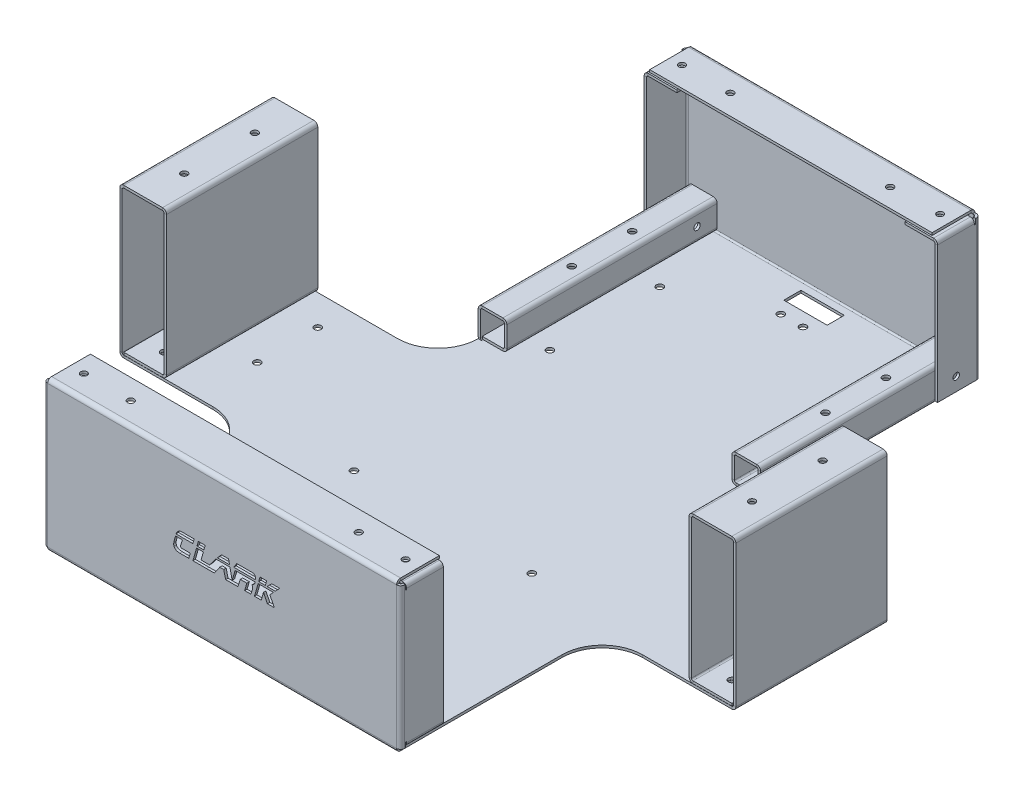
from build123d import *

# Parameters (mm, degrees)
BASE_FLANGE1_DEPTH                       = 1.21
M3_CLEARANCE_HOLE2_AT_2_COUNT            = 2
M3_CLEARANCE_HOLE2_AT_2_PITCH            = 66
M3_CLEARANCE_HOLE2_AT_3_COUNT            = 2
M3_CLEARANCE_HOLE2_AT_3_PITCH            = 86.678897774
FILLET1_R                                = 20
SIDE_WALL_FLANGE1_STRIP_W                = 6.364
SIDE_WALL_FLANGE1_STRIP_H                = 1.21
SIDE_WALL_FLANGE1_STRIP_CUT_DEPTH        = 75
SIDE_WALL_FLANGE1_DEPTH                  = 75
SIDE_WALL_FLANGE2_STRIP_W                = 6.364
SIDE_WALL_FLANGE2_STRIP_H                = 1.21
SIDE_WALL_FLANGE2_STRIP_CUT_DEPTH        = 140
SIDE_WALL_FLANGE2_DEPTH                  = 140
EDGE_FLANGE3_DEPTH                       = 173
SKETCH62_W                               = 21.5
SKETCH62_H                               = 8.5
QRD_CLEARANCE_DEPTH                      = 10
QRD_HOLES_D                              = 3.4
QRD_HOLES_DEPTH                          = 1.27
QRD_HOLES_TIP                            = 1.021463052
SIDE_WALL_FLANGE3_DEPTH                  = 75
TAP_START                                = 71.762
TAP_DRILL_FOR_M4X0_7_TAP3_OUTLINE_R      = 1.65
TAP_DRILL_FOR_M4X0_7_TAP3_DEPTH          = 1.21
EDGE_FLANGE6_DEPTH                       = 140
SIDE_WALL_FLANGE4_DEPTH                  = 75
SIDE_START                               = -175
SIDE_WALL_FLANGE5_DEPTH                  = 75
EDGE_FLANGE10_DEPTH                      = 173
TAP_DRILL_FOR_M4X0_7_TAP1_REACH          = 393.729
TAP_DRILL_FOR_M4X0_7_TAP1_BORE_R         = 1.65
TAP_DRILL_FOR_M4X0_7_TAP2_REACH          = 393.729
TAP_DRILL_FOR_M4X0_7_TAP2_BORE_R         = 1.65
M3_CLEARANCE_HOLE9_D                     = 3.4
M3_CLEARANCE_HOLE9_DEPTH                 = 2.51
FRONT_WHEEL_SUPPORT1_STRIP_W             = 6.364
FRONT_WHEEL_SUPPORT1_STRIP_H             = 1.21
FRONT_WHEEL_SUPPORT1_STRIP_CUT_DEPTH     = 104.238
FRONT_WHEEL_SUPPORT1_DEPTH               = 104.238
FRONT_WHEEL_SUPPORT2_STRIP_W             = 6.364
FRONT_WHEEL_SUPPORT2_STRIP_H             = 1.21
FRONT_WHEEL_SUPPORT2_STRIP_CUT_DEPTH     = 104.238
FRONT_WHEEL_SUPPORT2_DEPTH               = 104.238
FRONT_WHEEL_SUPPORT3_STRIP_W             = 6.364
FRONT_WHEEL_SUPPORT3_STRIP_H             = 1.21
FRONT_WHEEL_SUPPORT3_STRIP_CUT_DEPTH     = 104.238
FRONT_WHEEL_SUPPORT3_DEPTH               = 104.238
FRONT_START                              = -299.238
FRONT_WHEEL_SUPPORT4_DEPTH               = 104.238
FRONT_WHEEL_SUPPORT4_2_DEPTH             = 104.238
M3_STEERING_BOX_D                        = 3.4
M3_STEERING_BOX_DEPTH                    = 3
M3_STEERING_BOX_TIP                      = 1.021463052
M3_CLEARANCE_HOLE10_D                    = 3.4
M3_CLEARANCE_HOLE11_D                    = 3.4
REAR_WALL_SIDE_FLANGE1_DEPTH             = 70.238
REAR_WALL_SIDE_FLANGE2_STRIP_W           = 6.364
REAR_WALL_SIDE_FLANGE2_STRIP_H           = 1.21
REAR_WALL_SIDE_FLANGE2_STRIP_CUT_DEPTH   = 18.238
REAR_WALL_SIDE_FLANGE2_RELIEF_W          = 6.969
REAR_WALL_SIDE_FLANGE2_RELIEF_H          = 0.605
REAR_WALL_SIDE_FLANGE2_RELIEF_CUT_DEPTH  = 1.21
REAR_WALL_SIDE_FLANGE2_DEPTH             = 18.238
REAR_WALL_SIDE_FLANGE3_STRIP_W           = 6.364
REAR_WALL_SIDE_FLANGE3_STRIP_H           = 1.21
REAR_WALL_SIDE_FLANGE3_STRIP_CUT_DEPTH   = 18.238
REAR_WALL_SIDE_FLANGE3_RELIEF_W          = 6.969
REAR_WALL_SIDE_FLANGE3_RELIEF_H          = 0.605
REAR_WALL_SIDE_FLANGE3_RELIEF_CUT_DEPTH  = 1.21
REAR_WALL_SIDE_FLANGE3_DEPTH             = 18.238
SKETCH157_R                              = 1.6
CUT_EXTRUDE12_DEPTH                      = 10
CUT_EXTRUDE13_START                      = -10
SKETCH158_R                              = 1.6
CUT_EXTRUDE13_DEPTH                      = 10
FRONT_WALL_SIDE_FLANGE1_DEPTH            = 69.601632971
FRONT_WALL_SIDE_FLANGE2_STRIP_W          = 6.364
FRONT_WALL_SIDE_FLANGE2_STRIP_H          = 1.21
FRONT_WALL_SIDE_FLANGE2_STRIP_CUT_DEPTH  = 18.238
FRONT_WALL_SIDE_FLANGE2_RELIEF_W         = 6.969
FRONT_WALL_SIDE_FLANGE2_RELIEF_H         = 0.605
FRONT_WALL_SIDE_FLANGE2_RELIEF_CUT_DEPTH = 1.21
FRONT_WALL_SIDE_FLANGE2_DEPTH            = 18.238
SKETCH172_R                              = 1.6
CUT_EXTRUDE15_DEPTH                      = 10
SKETCH179_R                              = 1.6
FRONT_WALL_RIVET_HOLE_DEPTH              = 374.529954467
H_BRIDGE_M3_CLEARANCE_AT_2_COUNT         = 2
H_BRIDGE_M3_CLEARANCE_AT_2_PITCH         = 30
CUT_EXTRUDE16_DEPTH                      = 1.21


# Read off the part's stored shape, not the designer's step: Tap Drill for M4x0.7 Tap3, Side Wall Flange5, Front Wheel Support4
# Sheet-metal steps are written as plain solids
with BuildPart() as part:
    # Sketch1 → Base-Flange1 (new body)
    with BuildSketch(Plane(origin=(0, 0, 0), x_dir=(1, 0, 0), z_dir=(0, 1, 0))):
        Polygon((0, 0), (173, 0), (173, 100), (238, 100), (238, 175), (156.5, 175), (156.5, 300), (16.5, 300), (16.5, 175), (-65, 175), (-65, 100), (0, 100), align=None)
    extrude(amount=-BASE_FLANGE1_DEPTH)

    # Sketch28 → M3 Clearance Hole2 (revolve, cut)
    with BuildSketch(Plane(origin=(9.052, -1.21, -27.479586063), x_dir=(0, 0, -1), z_dir=(1, 0, 0))):
        Polygon((0, 0), (0, 2.291463052), (1.7, 1.27), (1.7, 0), align=None)
    m3_clearance_hole2 = revolve(axis=Axis((9.052, -7.56, -27.479586063), (0, 1, 0)), mode=Mode.SUBTRACT)

    # M3 Clearance Hole2 at 2: M3 Clearance Hole2 ×2
    with Locations(*[(i * M3_CLEARANCE_HOLE2_AT_2_PITCH, 0, 0) for i in range(1, M3_CLEARANCE_HOLE2_AT_2_COUNT)]):
        add(m3_clearance_hole2, mode=Mode.SUBTRACT)

    # M3 Clearance Hole2 at 3: M3 Clearance Hole2 ×2
    with Locations(*[Vector(0.38492784467456836, 0, -0.9229466693120418) * (i * M3_CLEARANCE_HOLE2_AT_3_PITCH) for i in range(1, M3_CLEARANCE_HOLE2_AT_3_COUNT)]):
        add(m3_clearance_hole2, mode=Mode.SUBTRACT)

    # Mirror3: M3 Clearance Hole2 across plane
    add(m3_clearance_hole2.mirror(Plane(origin=(86.5, 0, 0), x_dir=(0, 0, 1), z_dir=(1, 0, 0))), mode=Mode.SUBTRACT)

    # Mirror3 copy 1 sketch → Mirror3 copy 1 (revolve, cut)
    with BuildSketch(Plane(origin=(97.948, -1.21, -27.479586063), x_dir=(0, 0, -1), z_dir=(-1, 0, 0))):
        Polygon((0, 0), (0, -2.291463052), (1.7, -1.27), (1.7, 0), align=None)
    revolve(axis=Axis((97.948, -7.56, -27.479586063), (0, -1, 0)), mode=Mode.SUBTRACT)

    # Mirror3 copy 2 sketch → Mirror3 copy 2 (revolve, cut)
    with BuildSketch(Plane(origin=(130.582878701, -1.21, -107.479586063), x_dir=(0, 0, -1), z_dir=(-1, 0, 0))):
        Polygon((0, 0), (0, -2.291463052), (1.7, -1.27), (1.7, 0), align=None)
    revolve(axis=Axis((130.582878701, -7.56, -107.479586063), (0, -1, 0)), mode=Mode.SUBTRACT)

    # Fillet1
    fillet1_edges = [part.edges().sort_by_distance(p)[0] for p in [
        (0, -0.605, -100),
        (16.5, -0.605, -175),
        (156.5, -0.605, -175),
        (173, -0.605, -100),
    ]]
    fillet(fillet1_edges, radius=FILLET1_R)

    # Side Wall Flange1 strip (across the edge) → Side Wall Flange1 strip cut (cut)
    with BuildSketch(Plane(origin=(238, 0, -100), x_dir=(-1, 0, 0), z_dir=(0, 0, -1))):
        with Locations((-2.42, -0.605)):
            Rectangle(SIDE_WALL_FLANGE1_STRIP_W, SIDE_WALL_FLANGE1_STRIP_H)
    side_wall_flange1_strip_cut = extrude(amount=SIDE_WALL_FLANGE1_STRIP_CUT_DEPTH, mode=Mode.SUBTRACT)

    # Side Wall Flange1 section (across the edge) → Side Wall Flange1 (add)
    with BuildSketch(Plane(origin=(238, 0, -100), x_dir=(-1, 0, 0), z_dir=(0, 0, -1))):
        with BuildLine():
            Line((-1.21, 0.762), (-1.21, 71))
            Line((-1.21, 71), (0, 71))
            Line((0, 71), (0, 0.762))
            ThreePointArc((0, 0.762), (0.223184633, 0.223184633), (0.762, 0))
            Line((0.762, 0), (0.762, -1.21))
            ThreePointArc((0.762, -1.21), (-0.632414572, -0.632414572), (-1.21, 0.762))
        make_face()
    side_wall_flange1 = extrude(amount=SIDE_WALL_FLANGE1_DEPTH)

    # Side Wall Flange2 strip (across the edge) → Side Wall Flange2 strip cut (cut)
    with BuildSketch(Plane(origin=(156.5, 0, -300), x_dir=(0, 0, 1), z_dir=(-1, 0, 0))):
        with Locations((-2.42, -0.605)):
            Rectangle(SIDE_WALL_FLANGE2_STRIP_W, SIDE_WALL_FLANGE2_STRIP_H)
    extrude(amount=SIDE_WALL_FLANGE2_STRIP_CUT_DEPTH, mode=Mode.SUBTRACT)

    # Side Wall Flange2 section (across the edge) → Side Wall Flange2 (add)
    with BuildSketch(Plane(origin=(156.5, 0, -300), x_dir=(0, 0, 1), z_dir=(-1, 0, 0))):
        with BuildLine():
            Line((-1.21, 0.762), (-1.21, 71))
            Line((-1.21, 71), (0, 71))
            Line((0, 71), (0, 0.762))
            ThreePointArc((0, 0.762), (0.223184633, 0.223184633), (0.762, 0))
            Line((0.762, 0), (0.762, -1.21))
            ThreePointArc((0.762, -1.21), (-0.632414572, -0.632414572), (-1.21, 0.762))
        make_face()
    extrude(amount=SIDE_WALL_FLANGE2_DEPTH)

    # Side Wall Mirror: Side Wall Flange1 strip cut, Side Wall Flange1 across plane
    add(side_wall_flange1_strip_cut.mirror(Plane(origin=(86.5, 0, 0), x_dir=(0, 0, 1), z_dir=(1, 0, 0))), mode=Mode.SUBTRACT)
    add(side_wall_flange1.mirror(Plane(origin=(86.5, 0, 0), x_dir=(0, 0, 1), z_dir=(1, 0, 0))))

    # Edge-Flange3 section (across the edge) → Edge-Flange3 (add)
    with BuildSketch(Plane(origin=(0, 0, 0.762), x_dir=(0, 0, -1), z_dir=(1, 0, 0))):
        with BuildLine():
            Line((-1.21, 0.762), (-1.21, 71))
            Line((-1.21, 71), (0, 71))
            Line((0, 71), (0, 0.762))
            ThreePointArc((0, 0.762), (0.223184633, 0.223184633), (0.762, 0))
            Line((0.762, 0), (0.762, -1.21))
            ThreePointArc((0.762, -1.21), (-0.632414572, -0.632414572), (-1.21, 0.762))
        make_face()
    extrude(amount=EDGE_FLANGE3_DEPTH)

    # Sketch62 → QRD Clearance (cut)
    with BuildSketch(Plane(origin=(0, 0, 0), x_dir=(1, 0, 0), z_dir=(0, 1, 0))):
        with Locations((86.5, 291.488)):
            Rectangle(SKETCH62_W, SKETCH62_H)
    extrude(amount=-QRD_CLEARANCE_DEPTH, mode=Mode.SUBTRACT)

    # QRD Holes
    with Locations(Plane(origin=(0, 0, 0), x_dir=(1, 0, 0), z_dir=(0, 1, 0))):
        with Locations((92, 280.488), (81, 280.488)):
            Hole(QRD_HOLES_D / 2, depth=QRD_HOLES_DEPTH)
            with Locations((0, 0, -(QRD_HOLES_DEPTH + QRD_HOLES_TIP / 2))):  # 118° drill point
                Cone(0, QRD_HOLES_D / 2, QRD_HOLES_TIP, mode=Mode.SUBTRACT)

    # Side Wall Flange3 section (across the edge) → Side Wall Flange3 (add)
    with BuildSketch(Plane(origin=(-65, 71.762, -175), x_dir=(0, -1, 0), z_dir=(0, 0, 1))):
        with BuildLine():
            Line((-1.21, 0.762), (-1.21, 20))
            Line((-1.21, 20), (0, 20))
            Line((0, 20), (0, 0.762))
            ThreePointArc((0, 0.762), (0.223184633, 0.223184633), (0.762, 0))
            Line((0.762, 0), (0.762, -1.21))
            ThreePointArc((0.762, -1.21), (-0.632414572, -0.632414572), (-1.21, 0.762))
        make_face()
    side_wall_flange3 = extrude(amount=SIDE_WALL_FLANGE3_DEPTH)

    # Tap Drill for M4x0.7 Tap3 outline → Tap Drill for M4x0.7 Tap3 (cut)
    with BuildSketch(Plane(origin=(0, 0, 0), x_dir=(1, 0, 0), z_dir=(0, 1, 0)).offset(TAP_START)):
        with Locations((-54.238, 120)):
            Circle(TAP_DRILL_FOR_M4X0_7_TAP3_OUTLINE_R)
        with Locations((-54.238, 155)):
            Circle(TAP_DRILL_FOR_M4X0_7_TAP3_OUTLINE_R)
    tap_drill_for_m4x0_7_tap3 = extrude(amount=TAP_DRILL_FOR_M4X0_7_TAP3_DEPTH, mode=Mode.SUBTRACT)

    # Mirror6: Side Wall Flange3, Tap Drill for M4x0.7 Tap3 across plane
    add(side_wall_flange3.mirror(Plane(origin=(86.5, 0, 0), x_dir=(0, 0, 1), z_dir=(1, 0, 0))))
    add(tap_drill_for_m4x0_7_tap3.mirror(Plane(origin=(86.5, 0, 0), x_dir=(0, 0, 1), z_dir=(1, 0, 0))), mode=Mode.SUBTRACT)

    # Edge-Flange6 section (across the edge) → Edge-Flange6 (add)
    with BuildSketch(Plane(origin=(156.5, 71.762, -300), x_dir=(0, -1, 0), z_dir=(-1, 0, 0))):
        with BuildLine():
            Line((-1.21, 0.762), (-1.21, 20))
            Line((-1.21, 20), (0, 20))
            Line((0, 20), (0, 0.762))
            ThreePointArc((0, 0.762), (0.223184633, 0.223184633), (0.762, 0))
            Line((0.762, 0), (0.762, -1.21))
            ThreePointArc((0.762, -1.21), (-0.632414572, -0.632414572), (-1.21, 0.762))
        make_face()
    extrude(amount=EDGE_FLANGE6_DEPTH)

    # Side Wall Flange4 section (across the edge) → Side Wall Flange4 (add)
    with BuildSketch(Plane(origin=(-44.238, 71.762, -175), x_dir=(-1, 0, 0), z_dir=(0, 0, 1))):
        with BuildLine():
            Line((-1.21, 0.762), (-1.21, 69.7))
            Line((-1.21, 69.7), (0, 69.7))
            Line((0, 69.7), (0, 0.762))
            ThreePointArc((0, 0.762), (0.223184633, 0.223184633), (0.762, 0))
            Line((0.762, 0), (0.762, -1.21))
            ThreePointArc((0.762, -1.21), (-0.632414572, -0.632414572), (-1.21, 0.762))
        make_face()
    side_wall_flange4 = extrude(amount=SIDE_WALL_FLANGE4_DEPTH)

    # Side Wall Flange5 outline → Side Wall Flange5 (add)
    with BuildSketch(Plane.XY.offset(SIDE_START)):
        with BuildLine():
            Line((-64.238, 0.09), (-45, 0.09))
            ThreePointArc((-45, 0.09), (-43.605585427, 0.667585428), (-43.028, 2.062))
            Line((-43.028, 2.062), (-44.238, 2.062))
            ThreePointArc((-44.238, 2.062), (-44.461184633, 1.523184633), (-45, 1.3))
            Line((-45, 1.3), (-64.238, 1.3))
            Line((-64.238, 1.3), (-64.238, 0.09))
        make_face()
    side_wall_flange5 = extrude(amount=SIDE_WALL_FLANGE5_DEPTH)

    # Mirror7: Side Wall Flange4, Side Wall Flange5 across plane
    add(side_wall_flange4.mirror(Plane(origin=(86.5, 0, 0), x_dir=(0, 0, 1), z_dir=(1, 0, 0))))
    add(side_wall_flange5.mirror(Plane(origin=(86.5, 0, 0), x_dir=(0, 0, 1), z_dir=(1, 0, 0))))

    # Edge-Flange10 section (across the edge) → Edge-Flange10 (add)
    with BuildSketch(Plane(origin=(0, 71.762, 0.762), x_dir=(0, -1, 0), z_dir=(1, 0, 0))):
        with BuildLine():
            Line((-1.21, 0.762), (-1.21, 20))
            Line((-1.21, 20), (0, 20))
            Line((0, 20), (0, 0.762))
            ThreePointArc((0, 0.762), (0.223184633, 0.223184633), (0.762, 0))
            Line((0.762, 0), (0.762, -1.21))
            ThreePointArc((0.762, -1.21), (-0.632414572, -0.632414572), (-1.21, 0.762))
        make_face()
    extrude(amount=EDGE_FLANGE10_DEPTH)

    # Tap Drill for M4x0.7 Tap1 bore → Tap Drill for M4x0.7 Tap1 (cut, up to next)
    with BuildSketch(Plane(origin=(0, 72.972, 0), x_dir=(1, 0, 0), z_dir=(0, 1, 0)), mode=Mode.PRIVATE) as tap_drill_for_m4x0_7_tap1_sk1:
        with Locations((29.999061496, 9.238)):
            Circle(TAP_DRILL_FOR_M4X0_7_TAP1_BORE_R)
    tap_drill_for_m4x0_7_tap1_tool1 = extrude(tap_drill_for_m4x0_7_tap1_sk1.sketch, amount=-TAP_DRILL_FOR_M4X0_7_TAP1_REACH, mode=Mode.PRIVATE) & part.part
    # Tap Drill for M4x0.7 Tap1 bore → Tap Drill for M4x0.7 Tap1 (cut, up to next)
    with BuildSketch(Plane(origin=(0, 72.972, 0), x_dir=(1, 0, 0), z_dir=(0, 1, 0)), mode=Mode.PRIVATE) as tap_drill_for_m4x0_7_tap1_sk2:
        with Locations((143, 9.238)):
            Circle(TAP_DRILL_FOR_M4X0_7_TAP1_BORE_R)
    tap_drill_for_m4x0_7_tap1_tool2 = extrude(tap_drill_for_m4x0_7_tap1_sk2.sketch, amount=-TAP_DRILL_FOR_M4X0_7_TAP1_REACH, mode=Mode.PRIVATE) & part.part
    add(tap_drill_for_m4x0_7_tap1_tool1.solids().sort_by_distance((29.999061, 72.972, -9.238))[0], mode=Mode.SUBTRACT)
    add(tap_drill_for_m4x0_7_tap1_tool2.solids().sort_by_distance((143, 72.972, -9.238))[0], mode=Mode.SUBTRACT)

    # Tap Drill for M4x0.7 Tap2 bore → Tap Drill for M4x0.7 Tap2 (cut, up to next)
    with BuildSketch(Plane(origin=(0, 72.972, 0), x_dir=(1, 0, 0), z_dir=(0, 1, 0)), mode=Mode.PRIVATE) as tap_drill_for_m4x0_7_tap2_sk1:
        with Locations((46.5, 290)):
            Circle(TAP_DRILL_FOR_M4X0_7_TAP2_BORE_R)
    tap_drill_for_m4x0_7_tap2_tool1 = extrude(tap_drill_for_m4x0_7_tap2_sk1.sketch, amount=-TAP_DRILL_FOR_M4X0_7_TAP2_REACH, mode=Mode.PRIVATE) & part.part
    # Tap Drill for M4x0.7 Tap2 bore → Tap Drill for M4x0.7 Tap2 (cut, up to next)
    with BuildSketch(Plane(origin=(0, 72.972, 0), x_dir=(1, 0, 0), z_dir=(0, 1, 0)), mode=Mode.PRIVATE) as tap_drill_for_m4x0_7_tap2_sk2:
        with Locations((126.5, 289.238)):
            Circle(TAP_DRILL_FOR_M4X0_7_TAP2_BORE_R)
    tap_drill_for_m4x0_7_tap2_tool2 = extrude(tap_drill_for_m4x0_7_tap2_sk2.sketch, amount=-TAP_DRILL_FOR_M4X0_7_TAP2_REACH, mode=Mode.PRIVATE) & part.part
    add(tap_drill_for_m4x0_7_tap2_tool1.solids().sort_by_distance((46.5, 72.972, -290))[0], mode=Mode.SUBTRACT)
    add(tap_drill_for_m4x0_7_tap2_tool2.solids().sort_by_distance((126.5, 72.972, -289.238))[0], mode=Mode.SUBTRACT)

    # M3 Clearance Hole9
    with Locations(Plane(origin=(0, 1.3, 0), x_dir=(1, 0, 0), z_dir=(0, 1, 0))):
        with Locations((-54.238, 110), (-54.238, 165)):
            m3_clearance_hole9 = Hole(M3_CLEARANCE_HOLE9_D / 2, depth=M3_CLEARANCE_HOLE9_DEPTH)

    # Mirror10: M3 Clearance Hole9 across plane
    add(m3_clearance_hole9.mirror(Plane(origin=(86.5, 0, 0), x_dir=(0, 0, 1), z_dir=(1, 0, 0))), mode=Mode.SUBTRACT)

    # Front Wheel Support1 strip (across the edge) → Front Wheel Support1 strip cut (cut)
    with BuildSketch(Plane(origin=(156.5, 0, -195), x_dir=(-1, 0, 0), z_dir=(0, 0, -1))):
        with Locations((-1.21, -0.605)):
            Rectangle(FRONT_WHEEL_SUPPORT1_STRIP_W, FRONT_WHEEL_SUPPORT1_STRIP_H)
    front_wheel_support1_strip_cut = extrude(amount=FRONT_WHEEL_SUPPORT1_STRIP_CUT_DEPTH, mode=Mode.SUBTRACT)

    # Front Wheel Support1 section (across the edge) → Front Wheel Support1 (add)
    with BuildSketch(Plane(origin=(156.5, 0, -195), x_dir=(-1, 0, 0), z_dir=(0, 0, -1))):
        with BuildLine():
            Line((0, 0.762), (0, 15))
            Line((0, 15), (1.21, 15))
            Line((1.21, 15), (1.21, 0.762))
            ThreePointArc((1.21, 0.762), (1.433184633, 0.223184633), (1.972, 0))
            Line((1.972, 0), (1.972, -1.21))
            ThreePointArc((1.972, -1.21), (0.577585428, -0.632414572), (0, 0.762))
        make_face()
    front_wheel_support1 = extrude(amount=FRONT_WHEEL_SUPPORT1_DEPTH)

    # Front Wheel Support2 strip (across the edge) → Front Wheel Support2 strip cut (cut)
    with BuildSketch(Plane(origin=(155.29, 15, -195), x_dir=(0, -1, 0), z_dir=(0, 0, -1))):
        with Locations((-1.21, -0.605)):
            Rectangle(FRONT_WHEEL_SUPPORT2_STRIP_W, FRONT_WHEEL_SUPPORT2_STRIP_H)
    front_wheel_support2_strip_cut = extrude(amount=FRONT_WHEEL_SUPPORT2_STRIP_CUT_DEPTH, mode=Mode.SUBTRACT)

    # Front Wheel Support2 section (across the edge) → Front Wheel Support2 (add)
    with BuildSketch(Plane(origin=(155.29, 15, -195), x_dir=(0, -1, 0), z_dir=(0, 0, -1))):
        with BuildLine():
            Line((0, 0.762), (0, 13))
            Line((0, 13), (1.21, 13))
            Line((1.21, 13), (1.21, 0.762))
            ThreePointArc((1.21, 0.762), (1.433184633, 0.223184633), (1.972, 0))
            Line((1.972, 0), (1.972, -1.21))
            ThreePointArc((1.972, -1.21), (0.577585428, -0.632414572), (0, 0.762))
        make_face()
    front_wheel_support2 = extrude(amount=FRONT_WHEEL_SUPPORT2_DEPTH)

    # Front Wheel Support3 strip (across the edge) → Front Wheel Support3 strip cut (cut)
    with BuildSketch(Plane(origin=(142.29, 13.79, -195), x_dir=(1, 0, 0), z_dir=(0, 0, -1))):
        with Locations((-1.21, -0.605)):
            Rectangle(FRONT_WHEEL_SUPPORT3_STRIP_W, FRONT_WHEEL_SUPPORT3_STRIP_H)
    front_wheel_support3_strip_cut = extrude(amount=FRONT_WHEEL_SUPPORT3_STRIP_CUT_DEPTH, mode=Mode.SUBTRACT)

    # Front Wheel Support3 section (across the edge) → Front Wheel Support3 (add)
    with BuildSketch(Plane(origin=(142.29, 13.79, -195), x_dir=(1, 0, 0), z_dir=(0, 0, -1))):
        with BuildLine():
            Line((0, 0.762), (0, 13.028))
            Line((0, 13.028), (1.21, 13.028))
            Line((1.21, 13.028), (1.21, 0.762))
            ThreePointArc((1.21, 0.762), (1.433184633, 0.223184633), (1.972, 0))
            Line((1.972, 0), (1.972, -1.21))
            ThreePointArc((1.972, -1.21), (0.577585428, -0.632414572), (0, 0.762))
        make_face()
    front_wheel_support3 = extrude(amount=FRONT_WHEEL_SUPPORT3_DEPTH)

    # Front Wheel Support4 outline → Front Wheel Support4 (cut)
    with BuildSketch(Plane.XY.offset(FRONT_START)):
        with BuildLine():
            Line((143.5, 0.762), (143.5, 0.915170707))
            ThreePointArc((143.5, 0.915170707), (142.620133989, 1.641727141), (142.29, 2.734))
            Line((142.29, 2.734), (142.29, 0.762))
            Line((142.29, 0.762), (143.5, 0.762))
        make_face()
    front_wheel_support4 = extrude(amount=FRONT_WHEEL_SUPPORT4_DEPTH, mode=Mode.SUBTRACT)

    # Front Wheel Support4 2 outline → Front Wheel Support4 2 (add)
    with BuildSketch(Plane.XY.offset(FRONT_START)):
        with BuildLine():
            ThreePointArc((143.5, 0.915170707), (143.873378955, 0.800671864), (144.262, 0.762))
            Line((144.262, 0.762), (154.5, 0.762))
            Line((154.5, 0.762), (154.5, 1.972))
            Line((154.5, 1.972), (144.262, 1.972))
            ThreePointArc((144.262, 1.972), (143.723184633, 2.195184633), (143.5, 2.734))
            Line((143.5, 2.734), (143.5, 0.915170707))
        make_face()
    front_wheel_support4_2 = extrude(amount=FRONT_WHEEL_SUPPORT4_2_DEPTH)

    # Copy of Front Wheel Support: Front Wheel Support1 strip cut, Front Wheel Support1, Front Wheel Support2 strip cut, Front Wheel Support2, Front Wheel Support3 strip cut, Front Wheel Support3, Front Wheel Support4, Front Wheel Support4 2 across plane
    add(front_wheel_support1_strip_cut.mirror(Plane(origin=(86.5, 0, 0), x_dir=(0, 0, 1), z_dir=(1, 0, 0))), mode=Mode.SUBTRACT)
    add(front_wheel_support1.mirror(Plane(origin=(86.5, 0, 0), x_dir=(0, 0, 1), z_dir=(1, 0, 0))))
    add(front_wheel_support2_strip_cut.mirror(Plane(origin=(86.5, 0, 0), x_dir=(0, 0, 1), z_dir=(1, 0, 0))), mode=Mode.SUBTRACT)
    add(front_wheel_support2.mirror(Plane(origin=(86.5, 0, 0), x_dir=(0, 0, 1), z_dir=(1, 0, 0))))
    add(front_wheel_support3_strip_cut.mirror(Plane(origin=(86.5, 0, 0), x_dir=(0, 0, 1), z_dir=(1, 0, 0))), mode=Mode.SUBTRACT)
    add(front_wheel_support3.mirror(Plane(origin=(86.5, 0, 0), x_dir=(0, 0, 1), z_dir=(1, 0, 0))))
    add(front_wheel_support4.mirror(Plane(origin=(86.5, 0, 0), x_dir=(0, 0, 1), z_dir=(1, 0, 0))), mode=Mode.SUBTRACT)
    add(front_wheel_support4_2.mirror(Plane(origin=(86.5, 0, 0), x_dir=(0, 0, 1), z_dir=(1, 0, 0))))

    # M3 (Steering Box)
    with Locations(Plane(origin=(0, 0, 0), x_dir=(1, 0, 0), z_dir=(0, 1, 0))):
        with Locations((39.262, 262.238), (39.262, 207.762), (133.738, 207.762), (133.738, 262.238)):
            Hole(M3_STEERING_BOX_D / 2, depth=M3_STEERING_BOX_DEPTH)
            with Locations((0, 0, -(M3_STEERING_BOX_DEPTH + M3_STEERING_BOX_TIP / 2))):  # 118° drill point
                Cone(0, M3_STEERING_BOX_D / 2, M3_STEERING_BOX_TIP, mode=Mode.SUBTRACT)

    # M3 Clearance Hole10 (through all)
    with Locations(Plane(origin=(18.689012262, 15, -364.975799751), x_dir=(1, 0, 0), z_dir=(0, 1, 0))):
        with Locations((130.705987738, -100.737799751), (130.705987738, -130.737799751)):
            Hole(M3_CLEARANCE_HOLE10_D / 2)

    # M3 Clearance Hole11 (through all)
    with Locations(Plane(origin=(18.689012262, 15, -364.975799751), x_dir=(1, 0, 0), z_dir=(0, 1, 0))):
        with Locations((4.915987738, -100.737799751), (4.915987738, -130.737799751)):
            Hole(M3_CLEARANCE_HOLE11_D / 2)

    # Rear Wall Side Flange1 section (across the edge) → Rear Wall Side Flange1 (add)
    with BuildSketch(Plane(origin=(173.762, 71, 0.762), x_dir=(-1, 0, 0), z_dir=(0, -1, 0))):
        with BuildLine():
            Line((-1.21, 0.762), (-1.21, 20))
            Line((-1.21, 20), (0, 20))
            Line((0, 20), (0, 0.762))
            ThreePointArc((0, 0.762), (0.223184633, 0.223184633), (0.762, 0))
            Line((0.762, 0), (0.762, -1.21))
            ThreePointArc((0.762, -1.21), (-0.632414572, -0.632414572), (-1.21, 0.762))
        make_face()
    rear_wall_side_flange1 = extrude(amount=REAR_WALL_SIDE_FLANGE1_DEPTH)

    # Rear Wall Side Flange2 strip (across the edge) → Rear Wall Side Flange2 strip cut (cut)
    with BuildSketch(Plane(origin=(173.762, 71, -1), x_dir=(0, -1, 0), z_dir=(0, 0, -1))):
        with Locations((-1.21, -0.605)):
            Rectangle(REAR_WALL_SIDE_FLANGE2_STRIP_W, REAR_WALL_SIDE_FLANGE2_STRIP_H)
    rear_wall_side_flange2_strip_cut = extrude(amount=REAR_WALL_SIDE_FLANGE2_STRIP_CUT_DEPTH, mode=Mode.SUBTRACT)

    # Rear Wall Side Flange2 relief (on the sheet) → Rear Wall Side Flange2 relief cut (cut)
    with BuildSketch(Plane(origin=(173.762, 69.028, -1), x_dir=(0, -1, 0), z_dir=(-1, 0, 0))):
        with Locations((-2.8795, 0.3025)):
            Rectangle(REAR_WALL_SIDE_FLANGE2_RELIEF_W, REAR_WALL_SIDE_FLANGE2_RELIEF_H)
    rear_wall_side_flange2_relief_cut = extrude(amount=-REAR_WALL_SIDE_FLANGE2_RELIEF_CUT_DEPTH, mode=Mode.SUBTRACT)

    # Rear Wall Side Flange2 section (across the edge) → Rear Wall Side Flange2 (add)
    with BuildSketch(Plane(origin=(173.762, 71, -1), x_dir=(0, -1, 0), z_dir=(0, 0, -1))):
        with BuildLine():
            Line((0, 0.762), (0, 15))
            Line((0, 15), (1.21, 15))
            Line((1.21, 15), (1.21, 0.762))
            ThreePointArc((1.21, 0.762), (1.433184633, 0.223184633), (1.972, 0))
            Line((1.972, 0), (1.972, -1.21))
            ThreePointArc((1.972, -1.21), (0.577585428, -0.632414572), (0, 0.762))
        make_face()
    rear_wall_side_flange2 = extrude(amount=REAR_WALL_SIDE_FLANGE2_DEPTH)

    # Rear Wall Side Flange3 strip (across the edge) → Rear Wall Side Flange3 strip cut (cut)
    with BuildSketch(Plane(origin=(173.762, 0.762, -19.238), x_dir=(0, 1, 0), z_dir=(0, 0, 1))):
        with Locations((-1.21, -0.605)):
            Rectangle(REAR_WALL_SIDE_FLANGE3_STRIP_W, REAR_WALL_SIDE_FLANGE3_STRIP_H)
    rear_wall_side_flange3_strip_cut = extrude(amount=REAR_WALL_SIDE_FLANGE3_STRIP_CUT_DEPTH, mode=Mode.SUBTRACT)

    # Rear Wall Side Flange3 relief (on the sheet) → Rear Wall Side Flange3 relief cut (cut)
    with BuildSketch(Plane(origin=(173.762, 2.734, -19.238), x_dir=(0, 1, 0), z_dir=(-1, 0, 0))):
        with Locations((-2.8795, -18.5405)):
            Rectangle(REAR_WALL_SIDE_FLANGE3_RELIEF_W, REAR_WALL_SIDE_FLANGE3_RELIEF_H)
    rear_wall_side_flange3_relief_cut = extrude(amount=-REAR_WALL_SIDE_FLANGE3_RELIEF_CUT_DEPTH, mode=Mode.SUBTRACT)

    # Rear Wall Side Flange3 section (across the edge) → Rear Wall Side Flange3 (add)
    with BuildSketch(Plane(origin=(173.762, 0.762, -19.238), x_dir=(0, 1, 0), z_dir=(0, 0, 1))):
        with BuildLine():
            Line((0, 0.762), (0, 15))
            Line((0, 15), (1.21, 15))
            Line((1.21, 15), (1.21, 0.762))
            ThreePointArc((1.21, 0.762), (1.433184633, 0.223184633), (1.972, 0))
            Line((1.972, 0), (1.972, -1.21))
            ThreePointArc((1.972, -1.21), (0.577585428, -0.632414572), (0, 0.762))
        make_face()
    rear_wall_side_flange3 = extrude(amount=REAR_WALL_SIDE_FLANGE3_DEPTH)

    # Mirror15: Rear Wall Side Flange1 across plane
    add(rear_wall_side_flange1.mirror(Plane(origin=(86.5, 0, 0), x_dir=(0, 0, 1), z_dir=(1, 0, 0))))

    # Mirror16: Rear Wall Side Flange2 strip cut, Rear Wall Side Flange2 relief cut, Rear Wall Side Flange2, Rear Wall Side Flange3 strip cut, Rear Wall Side Flange3 relief cut, Rear Wall Side Flange3 across plane
    add(rear_wall_side_flange2_strip_cut.mirror(Plane(origin=(86.5, 0, 0), x_dir=(0, 0, 1), z_dir=(1, 0, 0))), mode=Mode.SUBTRACT)
    add(rear_wall_side_flange2_relief_cut.mirror(Plane(origin=(86.5, 0, 0), x_dir=(0, 0, 1), z_dir=(1, 0, 0))), mode=Mode.SUBTRACT)
    add(rear_wall_side_flange2.mirror(Plane(origin=(86.5, 0, 0), x_dir=(0, 0, 1), z_dir=(1, 0, 0))))
    add(rear_wall_side_flange3_strip_cut.mirror(Plane(origin=(86.5, 0, 0), x_dir=(0, 0, 1), z_dir=(1, 0, 0))), mode=Mode.SUBTRACT)
    add(rear_wall_side_flange3_relief_cut.mirror(Plane(origin=(86.5, 0, 0), x_dir=(0, 0, 1), z_dir=(1, 0, 0))), mode=Mode.SUBTRACT)
    add(rear_wall_side_flange3.mirror(Plane(origin=(86.5, 0, 0), x_dir=(0, 0, 1), z_dir=(1, 0, 0))))

    # Sketch157 → Cut-Extrude12 (cut)
    with BuildSketch(Plane(origin=(0, 1.972, 0), x_dir=(1, 0, 0), z_dir=(0, 1, 0))):
        with Locations(Location((166.262, 9.238, 0), (0, 0, 180))):
            Circle(SKETCH157_R)
    cut_extrude12 = extrude(amount=-CUT_EXTRUDE12_DEPTH, mode=Mode.SUBTRACT)

    # Sketch158 → Cut-Extrude13 (cut)
    with BuildSketch(Plane(origin=(0, 69.79, 0), x_dir=(-1, 0, 0), z_dir=(0, -1, 0)).offset(CUT_EXTRUDE13_START)):
        with Locations((-166.262, 9.238)):
            Circle(SKETCH158_R)
    cut_extrude13 = extrude(amount=CUT_EXTRUDE13_DEPTH, mode=Mode.SUBTRACT)

    # Mirror17: Cut-Extrude12, Cut-Extrude13 across plane
    add(cut_extrude12.mirror(Plane(origin=(86.5, 0, 0), x_dir=(0, 0, 1), z_dir=(1, 0, 0))), mode=Mode.SUBTRACT)
    add(cut_extrude13.mirror(Plane(origin=(86.5, 0, 0), x_dir=(0, 0, 1), z_dir=(1, 0, 0))), mode=Mode.SUBTRACT)

    # Front Wall Side Flange1 section (across the edge) → Front Wall Side Flange1 (add)
    with BuildSketch(Plane(origin=(15, 71, -300), x_dir=(1, 0, 0), z_dir=(0, -1, 0))):
        with BuildLine():
            Line((-1.21, 0.762), (-1.21, 20))
            Line((-1.21, 20), (0, 20))
            Line((0, 20), (0, 0.762))
            ThreePointArc((0, 0.762), (0.223184633, 0.223184633), (0.762, 0))
            Line((0.762, 0), (1.5, 0))
            Line((1.5, 0), (1.5, -1.21))
            Line((1.5, -1.21), (0.762, -1.21))
            ThreePointArc((0.762, -1.21), (-0.632414572, -0.632414572), (-1.21, 0.762))
        make_face()
    front_wall_side_flange1 = extrude(amount=FRONT_WALL_SIDE_FLANGE1_DEPTH)

    # Front Wall Side Flange2 strip (across the edge) → Front Wall Side Flange2 strip cut (cut)
    with BuildSketch(Plane(origin=(15, 71, -298.238), x_dir=(0, -1, 0), z_dir=(0, 0, 1))):
        with Locations((-1.21, -0.605)):
            Rectangle(FRONT_WALL_SIDE_FLANGE2_STRIP_W, FRONT_WALL_SIDE_FLANGE2_STRIP_H)
    front_wall_side_flange2_strip_cut = extrude(amount=FRONT_WALL_SIDE_FLANGE2_STRIP_CUT_DEPTH, mode=Mode.SUBTRACT)

    # Front Wall Side Flange2 relief (on the sheet) → Front Wall Side Flange2 relief cut (cut)
    with BuildSketch(Plane(origin=(15, 69.028, -298.238), x_dir=(0, -1, 0), z_dir=(1, 0, 0))):
        with Locations((-2.8795, 0.3025)):
            Rectangle(FRONT_WALL_SIDE_FLANGE2_RELIEF_W, FRONT_WALL_SIDE_FLANGE2_RELIEF_H)
    front_wall_side_flange2_relief_cut = extrude(amount=-FRONT_WALL_SIDE_FLANGE2_RELIEF_CUT_DEPTH, mode=Mode.SUBTRACT)

    # Front Wall Side Flange2 section (across the edge) → Front Wall Side Flange2 (add)
    with BuildSketch(Plane(origin=(15, 71, -298.238), x_dir=(0, -1, 0), z_dir=(0, 0, 1))):
        with BuildLine():
            Line((0, 0.762), (0, 15))
            Line((0, 15), (1.21, 15))
            Line((1.21, 15), (1.21, 0.762))
            ThreePointArc((1.21, 0.762), (1.433184633, 0.223184633), (1.972, 0))
            Line((1.972, 0), (1.972, -1.21))
            ThreePointArc((1.972, -1.21), (0.577585428, -0.632414572), (0, 0.762))
        make_face()
    front_wall_side_flange2 = extrude(amount=FRONT_WALL_SIDE_FLANGE2_DEPTH)

    # Sketch172 → Cut-Extrude15 (cut)
    with BuildSketch(Plane(origin=(0, 69.79, 0), x_dir=(-1, 0, 0), z_dir=(0, -1, 0))):
        with Locations(Location((-22.5, 290, 0), (0, 0, 90))):
            Circle(SKETCH172_R)
    cut_extrude15 = extrude(amount=-CUT_EXTRUDE15_DEPTH, mode=Mode.SUBTRACT)

    # Front Wall Side Mirror: Front Wall Side Flange1 across plane
    add(front_wall_side_flange1.mirror(Plane(origin=(86.5, 0, 0), x_dir=(0, 0, 1), z_dir=(1, 0, 0))))

    # Sketch179 → Front Wall Rivet Hole (cut, through all)
    with BuildSketch(Plane(origin=(30.71, 0, 0), x_dir=(0, 0, -1), z_dir=(1, 0, 0))):
        with Locations(Location((289.238, 8.028, 0), (0, 0, 90))):
            Circle(SKETCH179_R)
    front_wall_rivet_hole = extrude(amount=-FRONT_WALL_RIVET_HOLE_DEPTH, mode=Mode.SUBTRACT)

    # Front Wall Rivet Hole Mirror: Front Wall Side Flange2 strip cut, Front Wall Side Flange2 relief cut, Front Wall Side Flange2, Cut-Extrude15, Front Wall Rivet Hole across plane
    add(front_wall_side_flange2_strip_cut.mirror(Plane(origin=(86.5, 0, 0), x_dir=(0, 0, 1), z_dir=(1, 0, 0))), mode=Mode.SUBTRACT)
    add(front_wall_side_flange2_relief_cut.mirror(Plane(origin=(86.5, 0, 0), x_dir=(0, 0, 1), z_dir=(1, 0, 0))), mode=Mode.SUBTRACT)
    add(front_wall_side_flange2.mirror(Plane(origin=(86.5, 0, 0), x_dir=(0, 0, 1), z_dir=(1, 0, 0))))
    add(cut_extrude15.mirror(Plane(origin=(86.5, 0, 0), x_dir=(0, 0, 1), z_dir=(1, 0, 0))), mode=Mode.SUBTRACT)
    add(front_wall_rivet_hole.mirror(Plane(origin=(86.5, 0, 0), x_dir=(0, 0, 1), z_dir=(1, 0, 0))), mode=Mode.SUBTRACT)

    # Sketch193 → H-Bridge M3 Clearance (revolve, cut)
    with BuildSketch(Plane(origin=(201.028, 0, -160), x_dir=(0, 0, 1), z_dir=(1, 0, 0))):
        Polygon((0, 0), (0, 3.531463052), (1.7, 2.51), (1.7, 0), align=None)
    h_bridge_m3_clearance = revolve(axis=Axis((201.028, 6.35, -160), (0, -1, 0)), mode=Mode.SUBTRACT)

    # H-Bridge M3 Clearance at 2: H-Bridge M3 Clearance ×2
    with Locations(*[(0, 0, i * H_BRIDGE_M3_CLEARANCE_AT_2_PITCH) for i in range(1, H_BRIDGE_M3_CLEARANCE_AT_2_COUNT)]):
        add(h_bridge_m3_clearance, mode=Mode.SUBTRACT)

    # H-Bridge M3 Mirror: H-Bridge M3 Clearance across plane
    add(h_bridge_m3_clearance.mirror(Plane(origin=(86.5, 0, 0), x_dir=(0, 0, 1), z_dir=(1, 0, 0))), mode=Mode.SUBTRACT)

    # H-Bridge M3 Mirror copy 1 sketch → H-Bridge M3 Mirror copy 1 (revolve, cut)
    with BuildSketch(Plane(origin=(-28.028, 0, -130), x_dir=(0, 0, 1), z_dir=(-1, 0, 0))):
        Polygon((0, 0), (0, -3.531463052), (1.7, -2.51), (1.7, 0), align=None)
    revolve(axis=Axis((-28.028, 6.35, -130), (0, 1, 0)), mode=Mode.SUBTRACT)

    # Sketch195 → Cut-Extrude16 (cut)
    with BuildSketch(Plane.XY.offset(1.972)):
        with BuildLine():
            Line((72.656140259, 40.530023437), (71.970657552, 38.214257812))
            Line((71.970657552, 38.214257812), (63.654405477, 38.214257812))
            add(Edge.make_bspline(
                [(63.654405477, 38.214257812), (63.676640284, 38.2850619), (63.721112621, 38.426678746), (63.809682315, 38.630926004), (63.907521959, 38.832106926), (64.023447939, 39.026097035), (64.14938869, 39.217725113), (64.290588995, 39.403532668), (64.448062849, 39.581953385), (64.560480229, 39.69629249), (64.617297607, 39.754081136)],
                knots=[0, 0, 0, 0, 0.969584053, 1.939286824, 2.906969419, 3.892567764, 4.891161531, 5.903872825, 6.940586855, 8, 8, 8, 8], degree=3))
            add(Edge.make_bspline(
                [(64.617297607, 39.754081136), (64.68282294, 39.815298604), (64.810761547, 39.934826079), (65.011360007, 40.094325628), (65.216414478, 40.228022128), (65.421834493, 40.338623209), (65.629779574, 40.424983454), (65.839512744, 40.485095076), (66.05188381, 40.523068698), (66.19449047, 40.527707823), (66.265672445, 40.530023437)],
                knots=[0, 0, 0, 0, 1.151042241, 2.247416924, 3.285395898, 4.289929018, 5.238920285, 6.170118847, 7.086616619, 8, 8, 8, 8], degree=3))
            Line((66.265672445, 40.530023437), (72.656140259, 40.530023437))
        make_face()
        with BuildLine():
            Line((70.68814152, 33.454072917), (69.962454549, 30.881))
            Line((69.962454549, 30.881), (65.560087606, 30.881))
            add(Edge.make_bspline(
                [(65.560087606, 30.881), (65.466934375, 30.882365553), (65.284508607, 30.88503977), (65.017290536, 30.899833902), (64.763218811, 30.931007527), (64.521768768, 30.971152839), (64.292051792, 31.019624302), (64.077139422, 31.08514092), (63.87441492, 31.158870086), (63.685529176, 31.246096799), (63.507649159, 31.341569285), (63.344021045, 31.451309921), (63.192487285, 31.571434216), (63.055872113, 31.705330419), (62.930073495, 31.848592749), (62.817241977, 32.003698939), (62.718168795, 32.170634519), (62.664318745, 32.28895324), (62.63723759, 32.348455648)],
                knots=[0, 0, 0, 0, 1.285130438, 2.516723288, 3.689614434, 4.814121375, 5.892908561, 6.925234272, 7.910815483, 8.866288762, 9.792843532, 10.692686491, 11.58048512, 12.456415222, 13.327699743, 14.207765629, 15.098686514, 16, 16, 16, 16], degree=3))
            add(Edge.make_bspline(
                [(62.63723759, 32.348455648), (62.608632574, 32.428193687), (62.547379196, 32.598940812), (62.503683143, 32.887582876), (62.490386682, 33.217032485), (62.506218523, 33.449429153), (62.514614583, 33.572675496)],
                knots=[0, 0, 0, 0, 0.817267469, 1.750056471, 2.806793075, 4, 4, 4, 4], degree=3))
            add(Edge.make_bspline(
                [(62.514614583, 33.572675496), (62.518087974, 33.603485911), (62.526237221, 33.67577311), (62.536667253, 33.79938193), (62.556841708, 33.953124724), (62.568525738, 34.065813993), (62.57492098, 34.127494344)],
                knots=[0, 0, 0, 0, 0.666647788, 1.56408479, 2.666704423, 4, 4, 4, 4], degree=3))
            Line((62.57492098, 34.127494344), (63.383026693, 37.211161418))
            Line((63.383026693, 37.211161418), (66.828532145, 37.23126355))
            Line((66.828532145, 37.23126355), (65.83146639, 34.159657756))
            add(Edge.make_bspline(
                [(65.83146639, 34.159657756), (65.847196154, 34.09875819), (65.878576927, 33.977263974), (65.906159231, 33.854851551), (65.919915771, 33.79379895)],
                knots=[0, 0, 0, 0, 1.002509712, 2, 2, 2, 2], degree=3))
            add(Edge.make_bspline(
                [(65.919915771, 33.79379895), (65.944616242, 33.752572646), (65.994874903, 33.668688465), (66.113632861, 33.570928144), (66.262801133, 33.498163033), (66.3748455, 33.46939653), (66.434530355, 33.454072917)],
                knots=[0, 0, 0, 0, 0.898606002, 1.828415905, 2.843220022, 4, 4, 4, 4], degree=3))
            Line((66.434530355, 33.454072917), (70.68814152, 33.454072917))
        make_face()
        Polygon((78.113869141, 40.530023437), (77.428386434, 38.214257812), (74.06328951, 38.214257812), (74.7005271, 40.509921305), align=None)
        Polygon((80.731166748, 33.196765625), (78.791310994, 30.881), (72.034984375, 30.881), (73.826084351, 37.23126355), (77.197211914, 37.23126355), (76.083553792, 33.196765625), align=None)
        Polygon((90.18318929, 38.214257812), (84.186723267, 38.214257812), (86.180854777, 40.530023437), (89.688676839, 40.530023437), align=None)
        Polygon((91.731053467, 30.881), (88.243333537, 30.881), (87.300543538, 34.740609375), (85.3325448, 34.740609375), (82.538348429, 30.881), (78.467666667, 30.88703064), (83.440934163, 37.313682292), (90.374159546, 37.313682292), align=None)
        with BuildLine():
            Line((103.064635579, 38.214257812), (92.295923381, 38.214257812))
            Line((92.295923381, 38.214257812), (93.767399455, 40.530023437))
            Line((93.767399455, 40.530023437), (101.673568034, 40.530023437))
            add(Edge.make_bspline(
                [(101.673568034, 40.530023437), (101.727493346, 40.527408147), (101.837780734, 40.522059386), (102.002599334, 40.473379518), (102.170380699, 40.402041285), (102.276189154, 40.334023935), (102.330907756, 40.298848918)],
                knots=[0, 0, 0, 0, 0.913581768, 1.868446239, 2.897671833, 4, 4, 4, 4], degree=3))
            add(Edge.make_bspline(
                [(102.330907756, 40.298848918), (102.382123972, 40.261828434), (102.482178163, 40.189506526), (102.613177411, 40.063353434), (102.726174829, 39.928639071), (102.784498955, 39.829346102), (102.813358927, 39.780213908)],
                knots=[0, 0, 0, 0, 1.059583365, 2.069964611, 3.044978977, 4, 4, 4, 4], degree=3))
            add(Edge.make_bspline(
                [(102.813358927, 39.780213908), (102.833582862, 39.739016617), (102.876703204, 39.651178057), (102.927770263, 39.50491232), (102.968947358, 39.337709229), (103.005733379, 39.152088543), (103.03004565, 38.945670009), (103.050803131, 38.719845157), (103.062440408, 38.473695684), (103.063887094, 38.302718049), (103.064635579, 38.214257812)],
                knots=[0, 0, 0, 0, 0.68813208, 1.467196756, 2.318188026, 3.270514463, 4.304265893, 5.434736438, 6.672786523, 8, 8, 8, 8], degree=3))
        make_face()
        with BuildLine():
            add(Edge.make_bspline(
                [(102.901808309, 37.185028646), (102.890056092, 37.114963791), (102.866335183, 36.973543497), (102.799925301, 36.766482573), (102.713307488, 36.562480785), (102.603508758, 36.361884515), (102.469890477, 36.164366691), (102.312534482, 35.970085383), (102.133395648, 35.777561058), (101.999569317, 35.65821921), (101.930875326, 35.596960205)],
                knots=[0, 0, 0, 0, 0.89522961, 1.806949233, 2.734865869, 3.688117976, 4.686871091, 5.73903451, 6.839430601, 8, 8, 8, 8], degree=3))
            add(Edge.make_bspline(
                [(101.930875326, 35.596960205), (101.867841064, 35.543895638), (101.750854124, 35.445411718), (101.578629836, 35.31950495), (101.425937791, 35.222320358), (101.32499545, 35.178469051), (101.279566243, 35.158733724)],
                knots=[0, 0, 0, 0, 1.253750942, 2.326869253, 3.247005745, 4, 4, 4, 4], degree=3))
            add(Edge.make_bspline(
                [(101.279566243, 35.158733724), (101.329144076, 35.076308794), (101.425828716, 34.915567103), (101.52408672, 34.654351686), (101.587622304, 34.388545862), (101.595343678, 34.207588627), (101.599190145, 34.117443278)],
                knots=[0, 0, 0, 0, 1.043583065, 2.035152543, 3.021194923, 4, 4, 4, 4], degree=3))
            add(Edge.make_bspline(
                [(101.599190145, 34.117443278), (101.597839876, 34.058439793), (101.594873522, 33.928817301), (101.574531624, 33.719112543), (101.547479214, 33.47614805), (101.519603568, 33.304536316), (101.504710124, 33.212847331)],
                knots=[0, 0, 0, 0, 0.77775057, 1.708610381, 2.775752775, 4, 4, 4, 4], degree=3))
            add(Edge.make_bspline(
                [(101.504710124, 33.212847331), (101.497077265, 33.173889646), (101.47837869, 33.078453159), (101.432287999, 32.912538109), (101.366802796, 32.696661726), (101.285023059, 32.430420919), (101.183884553, 32.113452379), (101.063289184, 31.747128535), (100.924690444, 31.330077604), (100.824162914, 31.036373828), (100.7709823, 30.881)],
                knots=[0, 0, 0, 0, 0.389472445, 0.95410909, 1.688508646, 2.603699675, 3.68718707, 4.953583, 6.388398418, 8, 8, 8, 8], degree=3))
            Line((100.7709823, 30.881), (97.657162028, 30.881))
            Line((97.657162028, 30.881), (98.768809937, 34.611955729))
            Line((98.768809937, 34.611955729), (95.492162394, 34.611955729))
            Line((95.492162394, 34.611955729), (94.312167236, 30.881))
            Line((94.312167236, 30.881), (91.075723958, 30.881))
            Line((91.075723958, 30.881), (92.941201823, 37.185028646))
            Line((92.941201823, 37.185028646), (102.901808309, 37.185028646))
        make_face()
        Polygon((115.051536987, 40.530023437), (112.832261597, 38.214257812), (108.809824951, 38.214257812), (111.069304606, 40.530023437), align=None)
        Polygon((108.578650431, 40.530023437), (107.913269857, 38.214257812), (104.616520182, 38.214257812), (105.281900757, 40.530023437), align=None)
        Polygon((112.424188314, 30.881), (108.956570516, 30.881), (106.99661263, 34.76272172), (105.884964722, 30.881), (102.525898438, 30.881), (104.357202677, 37.23126355), (111.989982259, 37.23126355), (110.132545247, 35.353724406), align=None)
    extrude(amount=-CUT_EXTRUDE16_DEPTH, mode=Mode.SUBTRACT)


solid = part.part
